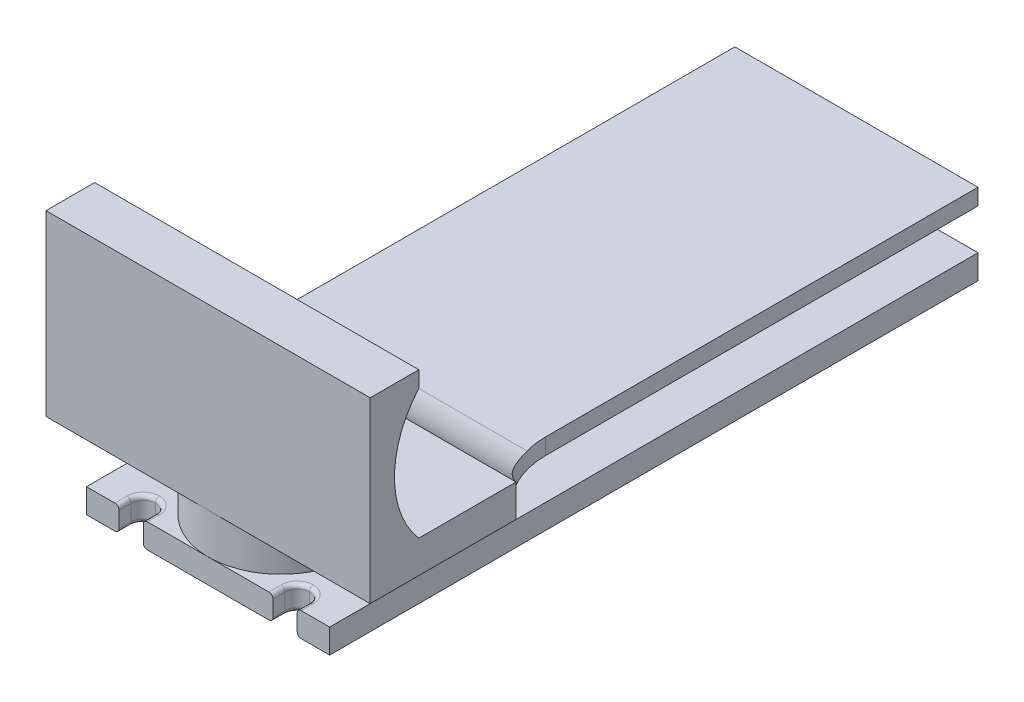
from build123d import *

# Parameters (mm, degrees)
SKETCH2_W                        = 30
SKETCH2_H                        = 18
EXTRUDE_BASE_DEPTH               = 3
SKETCH3_R                        = 9
EXTRUDE_CYLINDER_DEPTH           = 5
SKETCH4_W                        = 40
SKETCH4_H                        = 18
EXTRUDE_PHONE_FLOOR_DEPTH        = 4
SKETCH5_W                        = 40
SKETCH5_H                        = 6
EXTRUDE_PHONE_ROOF_DEPTH         = 18
CUT_PHONE_CRADLE_DEPTH           = 54.141321022
CUT_PHONE_CRADLE_DEPTH_BACK      = 54.141321022
CUT_RUBBER_BAND_HOLDERS_REACH    = 51.487
SKETCH7_W                        = 3
SKETCH7_H                        = 3
FILLET_RUBBER_BAND_HOLDERS_R     = 1.5
FILLET_RUBBER_BAND_HOLDERS_R_2   = 0.5
SKETCH8_W                        = 30
SKETCH8_H                        = 62
EXTRUDE_BASE_EXTENSION_DEPTH     = 3
EXTRUDE_CYLINDER_EXTENSION_DEPTH = 5
SKETCH10_W                       = 30
SKETCH10_H                       = 62
EXTRUDE_FLOOR_EXTENSION_DEPTH    = 2
FILLET1_R                        = 10


# Some blends are built 0.0001 mm under size
with BuildPart() as part:
    # Sketch2 → Extrude-Base (new body)
    with BuildSketch(Plane(origin=(0, 0, 0), x_dir=(1, 0, 0), z_dir=(0, 1, 0))):
        with Locations((15, -9)):
            Rectangle(SKETCH2_W, SKETCH2_H)
    extrude(amount=EXTRUDE_BASE_DEPTH)

    # Sketch3 → Extrude-Cylinder (add)
    with BuildSketch(Plane(origin=(0, 3, 0), x_dir=(1, 0, 0), z_dir=(0, 1, 0))):
        with Locations(Location((15, -9, 0), (0, 0, 270))):
            Circle(SKETCH3_R)
    extrude(amount=EXTRUDE_CYLINDER_DEPTH)

    # Sketch4 → Extrude-Phone Floor (add)
    with BuildSketch(Plane(origin=(0, 8, 0), x_dir=(1, 0, 0), z_dir=(0, 1, 0))):
        with Locations((15, -9)):
            Rectangle(SKETCH4_W, SKETCH4_H)
    extrude(amount=EXTRUDE_PHONE_FLOOR_DEPTH)

    # Sketch5 → Extrude-Phone Roof (add)
    with BuildSketch(Plane(origin=(0, 12, 0), x_dir=(1, 0, 0), z_dir=(0, 1, 0))):
        with Locations((15, -15)):
            Rectangle(SKETCH5_W, SKETCH5_H)
    extrude(amount=EXTRUDE_PHONE_ROOF_DEPTH)

    # Sketch6 → Cut-Phone Cradle (cut, two sides: drawn at the far end of the back side and taken through both)
    with BuildSketch(Plane(origin=(35, 0, 0), x_dir=(0, 0, -1), z_dir=(1, 0, 0)).offset(-CUT_PHONE_CRADLE_DEPTH_BACK)):
        with BuildLine():
            Line((-12, 12), (-12, 28))
            ThreePointArc((-12, 28), (-15, 20), (-12, 12))
        make_face()
    extrude(amount=CUT_PHONE_CRADLE_DEPTH + CUT_PHONE_CRADLE_DEPTH_BACK, mode=Mode.SUBTRACT)

    # Sketch7 → Cut-Rubber Band Holders (cut, up to next)
    with BuildSketch(Plane.XZ, mode=Mode.PRIVATE) as cut_rubber_band_holders_sk1:
        with Locations((24.5, 16.5)):
            Rectangle(SKETCH7_W, SKETCH7_H)
    cut_rubber_band_holders_tool1 = extrude(cut_rubber_band_holders_sk1.sketch, amount=-CUT_RUBBER_BAND_HOLDERS_REACH, mode=Mode.PRIVATE) & part.part
    # Sketch7 → Cut-Rubber Band Holders (cut, up to next)
    with BuildSketch(Plane.XZ, mode=Mode.PRIVATE) as cut_rubber_band_holders_sk2:
        with Locations((5.5, 16.5)):
            Rectangle(SKETCH7_W, SKETCH7_H)
    cut_rubber_band_holders_tool2 = extrude(cut_rubber_band_holders_sk2.sketch, amount=-CUT_RUBBER_BAND_HOLDERS_REACH, mode=Mode.PRIVATE) & part.part
    add(cut_rubber_band_holders_tool1.solids().sort_by_distance((24.5, 0, 16.5))[0], mode=Mode.SUBTRACT)
    add(cut_rubber_band_holders_tool2.solids().sort_by_distance((5.5, 0, 16.5))[0], mode=Mode.SUBTRACT)

    # Fillet-Rubber Band Holders
    fillet_rubber_band_holders_edges = [part.edges().sort_by_distance(p)[0] for p in [
        (26, 1.5, 15),
        (7, 1.5, 15),
        (23, 1.5, 15),
        (4, 1.5, 15),
    ]]
    fillet(fillet_rubber_band_holders_edges, radius=FILLET_RUBBER_BAND_HOLDERS_R - 0.0001)  # a hair under: the kernel refuses the full size
    fillet_rubber_band_holders_2_edges = [part.edges().sort_by_distance(p)[0] for p in [
        (24.5, 3, 15),
        (24.5, 0, 15),
        (5.5, 0, 15),
        (5.5, 3, 15),
        (6.560689461, 3, 15.439310539),
        (4.439310539, 3, 15.439310539),
        (4.439310539, 0, 15.439310539),
        (6.560689461, 0, 15.439310539),
        (23.439310539, 0, 15.439310539),
        (25.560689461, 0, 15.439310539),
        (25.560689461, 3, 15.439310539),
        (23.439310539, 3, 15.439310539),
    ]]
    fillet(fillet_rubber_band_holders_2_edges, radius=FILLET_RUBBER_BAND_HOLDERS_R_2)

    # Sketch8 → Extrude-Base Extension (add)
    with BuildSketch(Plane.XZ):
        with Locations((15, -31)):
            Rectangle(SKETCH8_W, SKETCH8_H)
    extrude(amount=-EXTRUDE_BASE_EXTENSION_DEPTH)

    # Sketch9 → Extrude-Cylinder Extension (add)
    with BuildSketch(Plane(origin=(0, 3, 0), x_dir=(1, 0, 0), z_dir=(0, 1, 0))):
        with BuildLine():
            Line((24, -9), (24, 53))
            ThreePointArc((24, 53), (15, 62), (6, 53))
            Line((6, 53), (6, -9))
            ThreePointArc((6, -9), (15, 0), (24, -9))
        make_face()
    extrude(amount=EXTRUDE_CYLINDER_EXTENSION_DEPTH)

    # Sketch10 → Extrude-Floor Extension (add)
    with BuildSketch(Plane(origin=(0, 8, 0), x_dir=(1, 0, 0), z_dir=(0, 1, 0))):
        with Locations((15, 31)):
            Rectangle(SKETCH10_W, SKETCH10_H)
    extrude(amount=EXTRUDE_FLOOR_EXTENSION_DEPTH)

    # Fillet1
    # the kernel refuses this fillet: 10 mm, written as the material it adds along each edge
    with BuildSketch(Plane(origin=(0, 8, 0), x_dir=(0, 0, -1), z_dir=(0, 1, 0))) as fillet1_piece_1:
        with BuildLine():
            CenterArc((8.660254038, 10), FILLET1_R, 210, 60)
            Line((0, 5), (-0.173205081, 4.9))
            ThreePointArc((-0.173205081, 4.9), (-0.2, 2.5), (-0.2, 0))
            Line((-0.2, 0), (0, -0.2))
            Line((0, -0.2), (8.660254038, -0.2))
            Line((8.660254038, -0.2), (8.660254038, 0))
        make_face()
    extrude(amount=2)
    with BuildSketch(Plane(origin=(0, 10, 0), x_dir=(0, 0, -1), z_dir=(1, 0, 0))) as fillet1_piece_2:
        with BuildLine():
            CenterArc((6, 10), FILLET1_R, 233.130102354, 36.869897646)
            Line((0, 2), (-0.12, 1.84))
            ThreePointArc((-0.12, 1.84), (-0.2, 1), (-0.2, 0))
            Line((-0.2, 0), (0, -0.2))
            Line((0, -0.2), (6, -0.2))
            Line((6, -0.2), (6, 0))
        make_face()
    extrude(amount=30)
    with BuildSketch(Plane(origin=(30, 8, 0), x_dir=(0, 0, -1), z_dir=(0, 1, 0))) as fillet1_piece_3:
        with BuildLine():
            CenterArc((8.660254038, -10), FILLET1_R, 90, 60)
            Line((0, -5), (-0.173205081, -4.9))
            ThreePointArc((-0.173205081, -4.9), (-0.2, -2.5), (-0.2, 0))
            Line((-0.2, 0), (0, 0.2))
            Line((0, 0.2), (8.660254038, 0.2))
            Line((8.660254038, 0.2), (8.660254038, 0))
        make_face()
    extrude(amount=2)
    with BuildSketch(Plane(origin=(-15, 10, 0), x_dir=(0, 0, -1), z_dir=(1, 0, 0))) as fillet1_piece_4a_section:
        with BuildLine():
            CenterArc((6, 10), FILLET1_R, 233.130102354, 36.869897646)
            Line((0, 2), (-0.12, 1.84))
            ThreePointArc((-0.12, 1.84), (-0.2, 1), (-0.2, 0))
            Line((-0.2, 0), (0, -0.2))
            Line((0, -0.2), (6, -0.2))
            Line((6, -0.2), (6, 0))
        make_face()
    fillet1_piece_4a = extrude(amount=45, mode=Mode.PRIVATE)
    fillet1_piece_4a = split(fillet1_piece_4a, bisect_by=Plane(origin=(0, 10.452376795, -1.699345627), z_dir=(-1, 0, 0)), keep=Keep.TOP, mode=Mode.PRIVATE)
    fillet1_piece_4a = split(fillet1_piece_4a, bisect_by=Plane(origin=(-5, 10.452376795, -1.699345627), z_dir=(1, 0, 0)), keep=Keep.TOP, mode=Mode.PRIVATE)
    with BuildSketch(Plane(origin=(0, 8, 0), x_dir=(0, 0, -1), z_dir=(0, 1, 0))) as fillet1_piece_4b_section:
        with BuildLine():
            CenterArc((8.660254038, 10), FILLET1_R, 210, 60)
            Line((0, 5), (-0.173205081, 4.9))
            ThreePointArc((-0.173205081, 4.9), (-0.2, 2.5), (-0.2, 0))
            Line((-0.2, 0), (0, -0.2))
            Line((0, -0.2), (8.660254038, -0.2))
            Line((8.660254038, -0.2), (8.660254038, 0))
        make_face()
    fillet1_piece_4b = extrude(amount=23.650635095, mode=Mode.PRIVATE)
    fillet1_piece_4b = split(fillet1_piece_4b, bisect_by=Plane(origin=(-1.295167111, 10, -2.163104458), z_dir=(0, 1, 0)), keep=Keep.TOP, mode=Mode.PRIVATE)
    fillet1_piece_4b = split(fillet1_piece_4b, bisect_by=Plane(origin=(-1.295167111, 12, -2.163104458), z_dir=(0, -1, 0)), keep=Keep.TOP, mode=Mode.PRIVATE)
    fillet1_piece_4 = fillet1_piece_4a & fillet1_piece_4b
    add(fillet1_piece_4)
    with BuildSketch(Plane(origin=(0, 10, 0), x_dir=(0, 0, -1), z_dir=(1, 0, 0))) as fillet1_piece_5a_section:
        with BuildLine():
            CenterArc((6, 10), FILLET1_R, 233.130102354, 36.869897646)
            Line((0, 2), (-0.12, 1.84))
            ThreePointArc((-0.12, 1.84), (-0.2, 1), (-0.2, 0))
            Line((-0.2, 0), (0, -0.2))
            Line((0, -0.2), (6, -0.2))
            Line((6, -0.2), (6, 0))
        make_face()
    fillet1_piece_5a = extrude(amount=45, mode=Mode.PRIVATE)
    fillet1_piece_5a = split(fillet1_piece_5a, bisect_by=Plane(origin=(30, 10.452376795, -1.699345627), z_dir=(1, 0, 0)), keep=Keep.TOP, mode=Mode.PRIVATE)
    fillet1_piece_5a = split(fillet1_piece_5a, bisect_by=Plane(origin=(35, 10.452376795, -1.699345627), z_dir=(-1, 0, 0)), keep=Keep.TOP, mode=Mode.PRIVATE)
    with BuildSketch(Plane(origin=(30, 8, 0), x_dir=(0, 0, -1), z_dir=(0, 1, 0))) as fillet1_piece_5b_section:
        with BuildLine():
            CenterArc((8.660254038, -10), FILLET1_R, 90, 60)
            Line((0, -5), (-0.173205081, -4.9))
            ThreePointArc((-0.173205081, -4.9), (-0.2, -2.5), (-0.2, 0))
            Line((-0.2, 0), (0, 0.2))
            Line((0, 0.2), (8.660254038, 0.2))
            Line((8.660254038, 0.2), (8.660254038, 0))
        make_face()
    fillet1_piece_5b = extrude(amount=23.650635095, mode=Mode.PRIVATE)
    fillet1_piece_5b = split(fillet1_piece_5b, bisect_by=Plane(origin=(31.295167111, 10, -2.163104458), z_dir=(0, 1, 0)), keep=Keep.TOP, mode=Mode.PRIVATE)
    fillet1_piece_5b = split(fillet1_piece_5b, bisect_by=Plane(origin=(31.295167111, 12, -2.163104458), z_dir=(0, -1, 0)), keep=Keep.TOP, mode=Mode.PRIVATE)
    fillet1_piece_5 = fillet1_piece_5a & fillet1_piece_5b
    add(fillet1_piece_5)


solid = part.part
